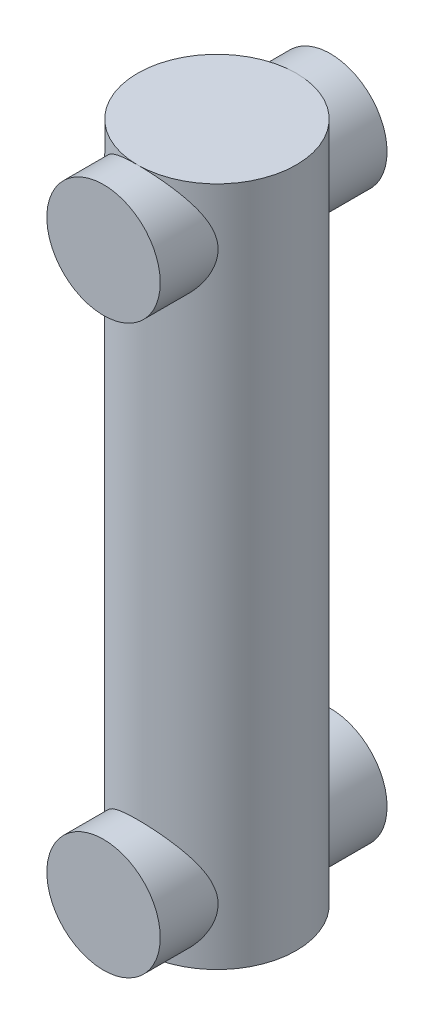
from build123d import *

# Parameters (mm, degrees)
SKIZZE1_R                            = 35
AUFSATZ_LINEAR_AUSTRAGEN1_DEPTH      = 300
AUFSATZ_LINEAR_AUSTRAGEN2_DEPTH      = 50
AUFSATZ_LINEAR_AUSTRAGEN2_DEPTH_BACK = 50
SKIZZE2_R                            = 25


with BuildPart() as part:
    # Skizze1 → Aufsatz-Linear austragen1 (new body)
    with BuildSketch(Plane(origin=(0, 0, 0), x_dir=(1, 0, 0), z_dir=(0, 1, 0))):
        Circle(SKIZZE1_R)
    extrude(amount=AUFSATZ_LINEAR_AUSTRAGEN1_DEPTH)

    # Skizze2 → Aufsatz-Linear austragen2 (add, two sides: drawn at the far end of the back side and taken through both)
    with BuildSketch(Plane.XY.offset(-AUFSATZ_LINEAR_AUSTRAGEN2_DEPTH_BACK)):
        with Locations((0, 25)):
            Circle(SKIZZE2_R)
        with Locations((0, 275)):
            Circle(SKIZZE2_R)
    extrude(amount=AUFSATZ_LINEAR_AUSTRAGEN2_DEPTH + AUFSATZ_LINEAR_AUSTRAGEN2_DEPTH_BACK)


solid = part.part
